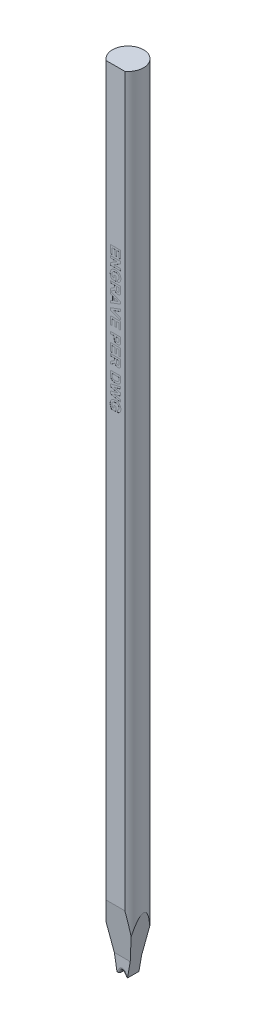
from build123d import *

# Parameters (mm, degrees)
SKETCH_TL_CUTTING_R       = 1.4986
TL_CUTTING_DEPTH          = 75.9968
SKETCH_TDF_GRINDING_W     = 3.0172
SKETCH_TDF_GRINDING_H     = 3.0172
TDF_GRINDING_DEPTH        = 77.026345527
ENGRAVING_DEPTH           = 0.005
VW_VR_GRINDING_DEPTH      = 1.5086
VW_VR_GRINDING_DEPTH_BACK = 1.5086
ISA_GRINDING_DEPTH        = 1.5086
ISA_GRINDING_DEPTH_BACK   = 1.5086
PRE_FRX_BRX_DEPTH         = 1.5086
PRE_FRX_BRX_DEPTH_BACK    = 1.5086
SKETCH_PRE_FRX_BRX_W      = 0.95742
SKETCH_PRE_FRX_BRX_H      = 1.4986
SKETCH_PRE_FRX_BRX_W_2    = 0.95996
FR_EDM_R                  = 0.24892
BR_EDM_R                  = 0.24892
FA_BA_GRINDING_DEPTH      = 1.5086
FA_BA_GRINDING_DEPTH_BACK = 1.5086


with BuildPart() as part:
    # sketch_TL_cutting → TL_cutting (new body)
    with BuildSketch(Plane(origin=(0, 0, 0), x_dir=(1, 0, 0), z_dir=(0, 1, 0))):
        Circle(SKETCH_TL_CUTTING_R)
    extrude(amount=TL_CUTTING_DEPTH)

    # sketch_TDF_grinding → TDF_grinding (cut, through all)
    with BuildSketch(Plane(origin=(0, 0, 0), x_dir=(1, 0, 0), z_dir=(0, 1, 0))):
        with Locations((0, -2.71002)):
            Rectangle(SKETCH_TDF_GRINDING_W, SKETCH_TDF_GRINDING_H)
    extrude(amount=TDF_GRINDING_DEPTH, mode=Mode.SUBTRACT)

    # sketch_engraving → engraving (cut)
    # profile 1 of 13: a face of its own
    with BuildSketch(Plane.XY.offset(1.20142)):
        Polygon((-0.5, 60.894235897), (0.5, 60.894235897), (0.5, 60.150646154), (0.333333333, 60.150646154), (0.333333333, 60.701928205), (0.115384615, 60.701928205), (0.115384615, 60.189107692), (-0.051282051, 60.189107692), (-0.051282051, 60.701928205), (-0.333333333, 60.701928205), (-0.333333333, 60.137825641), (-0.5, 60.137825641), align=None)
    # profile 2 of 13: a face of its own
    with BuildSketch(Plane.XY.offset(1.20142)):
        Polygon((-0.5, 59.971158974), (0.5, 59.971158974), (0.5, 59.7702375), (-0.157451923, 59.368594872), (0.5, 59.368594872), (0.5, 59.176287179), (-0.5, 59.176287179), (-0.5, 59.38341859), (0.147035256, 59.778851282), (-0.5, 59.778851282), align=None)
    # profile 3 of 13: a face of its own
    with BuildSketch(Plane.XY.offset(1.20142)):
        with BuildLine():
            Line((-0.128205128, 58.522441026), (0.038461538, 58.522441026))
            Line((0.038461538, 58.522441026), (0.038461538, 58.08654359))
            Line((0.038461538, 58.08654359), (-0.36338141, 58.08654359))
            add(Edge.make_bspline(
                [(-0.36338141, 58.08654359), (-0.368321434, 58.092029605), (-0.378419843, 58.103244131), (-0.392661125, 58.121541895), (-0.406257259, 58.14168601), (-0.4194836, 58.1635547), (-0.432233696, 58.187193223), (-0.444685123, 58.212507295), (-0.45671611, 58.239543622), (-0.471787381, 58.277776941), (-0.488186169, 58.326991061), (-0.502445448, 58.387156306), (-0.511191227, 58.447797498), (-0.512277771, 58.488358306), (-0.512820513, 58.50861891)],
                knots=[0, 0, 0, 0, 0.581799769, 1.189316438, 1.825828404, 2.496525428, 3.203088405, 3.942228803, 4.719818701, 5.534979611, 7.181138583, 8.803804008, 10.403462225, 12, 12, 12, 12], degree=3))
            add(Edge.make_bspline(
                [(-0.512820513, 58.50861891), (-0.512629241, 58.521311396), (-0.512252188, 58.546332062), (-0.509233571, 58.583270349), (-0.504017902, 58.618987455), (-0.496780719, 58.653419967), (-0.487836372, 58.686670877), (-0.476607913, 58.718623396), (-0.463065488, 58.749243299), (-0.447986133, 58.778759812), (-0.430657849, 58.806612408), (-0.411724289, 58.832856254), (-0.390891397, 58.857236635), (-0.36853351, 58.879965448), (-0.344060025, 58.900614033), (-0.318106216, 58.919695872), (-0.290219674, 58.936754268), (-0.260879177, 58.95208079), (-0.230317098, 58.965710173), (-0.198781008, 58.977212477), (-0.166726875, 58.987296153), (-0.134042675, 58.995583938), (-0.10062201, 59.001670885), (-0.066619552, 59.00640276), (-0.031822841, 59.008944234), (-0.008417054, 59.009393556), (0.003405449, 59.009620513)],
                knots=[0, 0, 0, 0, 1.124897971, 2.217508473, 3.282174662, 4.322209414, 5.334422951, 6.332119154, 7.320662553, 8.300074908, 9.267468154, 10.225199689, 11.165658754, 12.107290334, 13.047749399, 14.00069605, 14.959944213, 15.942088746, 16.933021067, 17.923599838, 18.915715637, 19.910475908, 20.909926025, 21.925232038, 22.952013513, 24, 24, 24, 24], degree=3))
            add(Edge.make_bspline(
                [(0.003405449, 59.009620513), (0.016165747, 59.009436614), (0.041321811, 59.009074069), (0.078501182, 59.005944425), (0.114594914, 59.00109647), (0.149519517, 58.993701478), (0.183523729, 58.984848027), (0.216299841, 58.973503339), (0.248180515, 58.960549892), (0.278688999, 58.945265774), (0.308028284, 58.928383202), (0.335510174, 58.909199631), (0.361403632, 58.88838003), (0.385591047, 58.865737199), (0.407627145, 58.840898237), (0.428063784, 58.814372539), (0.447146094, 58.78617769), (0.457908016, 58.766000967), (0.463341346, 58.755814423)],
                knots=[0, 0, 0, 0, 1.105132952, 2.178694671, 3.229818344, 4.257558797, 5.269123684, 6.27148554, 7.259679084, 8.247804916, 9.224967877, 10.189258471, 11.147685264, 12.101072275, 13.055511435, 14.02039165, 15.000562851, 16, 16, 16, 16], degree=3))
            add(Edge.make_bspline(
                [(0.463341346, 58.755814423), (0.467347168, 58.747727072), (0.475455657, 58.731356849), (0.485329628, 58.705283756), (0.494054347, 58.677916179), (0.500719187, 58.648934703), (0.506115234, 58.618648224), (0.510216979, 58.586907147), (0.512307439, 58.553652939), (0.512647258, 58.530990515), (0.512820513, 58.519436218)],
                knots=[0, 0, 0, 0, 0.887950456, 1.797368171, 2.741221183, 3.713797788, 4.722103116, 5.768966405, 6.862521341, 8, 8, 8, 8], degree=3))
            add(Edge.make_bspline(
                [(0.512820513, 58.519436218), (0.512598613, 58.504538718), (0.512167059, 58.475565835), (0.508571106, 58.433325541), (0.502373597, 58.393571904), (0.493837942, 58.356249565), (0.482863355, 58.321438928), (0.469371425, 58.289199918), (0.453633675, 58.25933466), (0.435019378, 58.232275716), (0.414494937, 58.207473149), (0.392035387, 58.18499168), (0.367607461, 58.164822262), (0.341334074, 58.146951549), (0.313106625, 58.131520198), (0.283182558, 58.118252182), (0.251334696, 58.107331), (0.22921692, 58.102053034), (0.217948718, 58.099364103)],
                knots=[0, 0, 0, 0, 1.271135529, 2.472123572, 3.614091059, 4.701890498, 5.736279567, 6.724681829, 7.680621489, 8.611506429, 9.52200816, 10.424540711, 11.318996785, 12.221421405, 13.131851814, 14.060431888, 15.011860567, 16, 16, 16, 16], degree=3))
            Line((0.217948718, 58.099364103), (0.179487179, 58.291671795))
            add(Edge.make_bspline(
                [(0.179487179, 58.291671795), (0.185798707, 58.293574377), (0.198251232, 58.297328136), (0.216108293, 58.304634712), (0.232994438, 58.312952834), (0.248643132, 58.322779827), (0.263649233, 58.333217482), (0.277161531, 58.345487665), (0.290187329, 58.358394684), (0.301701762, 58.37288584), (0.312086782, 58.388324395), (0.321450083, 58.404545863), (0.329043783, 58.421914205), (0.335153652, 58.440186828), (0.340342569, 58.459274233), (0.343533767, 58.479425571), (0.345940549, 58.50041453), (0.346081986, 58.514754556), (0.346153846, 58.522040385)],
                knots=[0, 0, 0, 0, 1.027780279, 2.027791312, 3.006028774, 3.96000864, 4.908113241, 5.852721087, 6.802883308, 7.765918715, 8.733730415, 9.704005314, 10.683351261, 11.68471758, 12.707948499, 13.764514378, 14.864202456, 16, 16, 16, 16], degree=3))
            add(Edge.make_bspline(
                [(0.346153846, 58.522040385), (0.345859633, 58.533067741), (0.34528545, 58.554588568), (0.341538784, 58.586006107), (0.334873123, 58.615645672), (0.325679114, 58.64358477), (0.313877959, 58.669874621), (0.299029501, 58.694159968), (0.282012344, 58.717045501), (0.262039987, 58.737879978), (0.239645267, 58.756774481), (0.214561065, 58.773131053), (0.186868462, 58.78674783), (0.156706511, 58.797900746), (0.124073954, 58.806780847), (0.088855272, 58.812804995), (0.051104495, 58.816741063), (0.02505068, 58.817118323), (0.01161859, 58.817312821)],
                knots=[0, 0, 0, 0, 1.043810997, 2.037086103, 2.989314757, 3.91471467, 4.817033861, 5.710208705, 6.603920097, 7.511448416, 8.435617211, 9.371747005, 10.338444094, 11.350425613, 12.411431869, 13.5347293, 14.729025275, 16, 16, 16, 16], degree=3))
            add(Edge.make_bspline(
                [(0.01161859, 58.817312821), (-0.002813331, 58.817110147), (-0.03086261, 58.816716238), (-0.071503034, 58.812881337), (-0.109371212, 58.806583116), (-0.14440027, 58.797515757), (-0.176807311, 58.786208494), (-0.206438048, 58.772228966), (-0.233109204, 58.75542113), (-0.256980675, 58.736358295), (-0.278169336, 58.715321484), (-0.296147735, 58.692258524), (-0.31184176, 58.668000317), (-0.32420794, 58.641860517), (-0.33413508, 58.614312028), (-0.341078682, 58.585085999), (-0.345395871, 58.554287729), (-0.345897627, 58.533206176), (-0.346153846, 58.522441026)],
                knots=[0, 0, 0, 0, 1.31821493, 2.562027667, 3.72541598, 4.821825939, 5.863743127, 6.857000185, 7.808227391, 8.737146514, 9.643023621, 10.529087527, 11.404035307, 12.277173472, 13.164790074, 14.074766194, 15.016892606, 16, 16, 16, 16], degree=3))
            add(Edge.make_bspline(
                [(-0.346153846, 58.522441026), (-0.345850315, 58.511537735), (-0.34524035, 58.489626847), (-0.340086045, 58.456805767), (-0.332449955, 58.423805514), (-0.321065283, 58.391413163), (-0.307937779, 58.360026456), (-0.292687307, 58.330860255), (-0.276962331, 58.303467677), (-0.264654274, 58.2869552), (-0.258613782, 58.278851282)],
                knots=[0, 0, 0, 0, 0.993779204, 1.997065276, 3.023588959, 4.078879359, 5.123947549, 6.123456565, 7.079038607, 8, 8, 8, 8], degree=3))
            Line((-0.258613782, 58.278851282), (-0.128205128, 58.278851282))
            Line((-0.128205128, 58.278851282), (-0.128205128, 58.522441026))
        make_face()
    # profile 4 of 13: a face of its own
    with BuildSketch(Plane.XY.offset(1.20142)):
        with BuildLine():
            Line((-0.5, 57.894235897), (0.5, 57.894235897))
            Line((0.5, 57.894235897), (0.5, 57.474564423))
            add(Edge.make_bspline(
                [(0.5, 57.474564423), (0.499921351, 57.461810201), (0.499769781, 57.437230481), (0.498665723, 57.401683268), (0.496349389, 57.368901265), (0.493735057, 57.338736822), (0.489890849, 57.311277094), (0.485377151, 57.286456079), (0.480042652, 57.264353829), (0.473762142, 57.2447266), (0.46640441, 57.226899938), (0.457825047, 57.210235326), (0.447696774, 57.194575272), (0.436444977, 57.179714477), (0.424039539, 57.165595254), (0.410155618, 57.152603274), (0.394999014, 57.140512567), (0.378696089, 57.129332781), (0.361318758, 57.119484096), (0.343425117, 57.110484982), (0.324824746, 57.103159364), (0.305605269, 57.09710847), (0.285808412, 57.092274923), (0.265383845, 57.088920032), (0.244368538, 57.086825611), (0.230173307, 57.086638641), (0.222956731, 57.08654359)],
                knots=[0, 0, 0, 0, 1.675792322, 3.229558513, 4.671612708, 5.993327294, 7.206773438, 8.313218507, 9.306927966, 10.191988363, 11.018030861, 11.838135071, 12.650980327, 13.465150207, 14.285535933, 15.117196726, 15.959844754, 16.83101188, 17.711363548, 18.582398133, 19.460517458, 20.334551361, 21.228266118, 22.135486512, 23.052118027, 24, 24, 24, 24], degree=3))
            add(Edge.make_bspline(
                [(0.222956731, 57.08654359), (0.213865176, 57.08671771), (0.196097772, 57.087057988), (0.170067915, 57.090259374), (0.145135532, 57.094860931), (0.121515047, 57.101974247), (0.099028777, 57.110818829), (0.077834712, 57.121624821), (0.057734109, 57.134377691), (0.039011166, 57.149143067), (0.021628172, 57.165861702), (0.005964946, 57.184627919), (-0.008142217, 57.205317705), (-0.020271369, 57.228100383), (-0.030960543, 57.252583224), (-0.039742833, 57.279088699), (-0.046961528, 57.30748005), (-0.050349413, 57.327234525), (-0.052083333, 57.337344872)],
                knots=[0, 0, 0, 0, 1.059179627, 2.069928931, 3.052909591, 4.01082991, 4.940120368, 5.865982481, 6.779263376, 7.710344595, 8.640547144, 9.585223395, 10.554458868, 11.553878165, 12.589111246, 13.664634927, 14.804759383, 16, 16, 16, 16], degree=3))
            add(Edge.make_bspline(
                [(-0.052083333, 57.337344872), (-0.058543192, 57.327554557), (-0.071157156, 57.308437315), (-0.092244136, 57.282140986), (-0.113935974, 57.258182324), (-0.13350323, 57.240195798), (-0.150629326, 57.226361316), (-0.165615492, 57.215228495), (-0.182859981, 57.203217912), (-0.202374991, 57.19044991), (-0.22398696, 57.176546224), (-0.248026974, 57.162024206), (-0.274260457, 57.146579885), (-0.292585876, 57.136196031), (-0.302083333, 57.130814423)],
                knots=[0, 0, 0, 0, 1.285482994, 2.510122655, 3.691653098, 4.826411195, 5.419869803, 6.105175889, 6.872935239, 7.723789235, 8.662129684, 9.690525463, 10.803075916, 12, 12, 12, 12], degree=3))
            Line((-0.302083333, 57.130814423), (-0.5, 57.009620513))
            Line((-0.5, 57.009620513), (-0.5, 57.234380128))
            Line((-0.5, 57.234380128), (-0.273036859, 57.376607692))
            add(Edge.make_bspline(
                [(-0.273036859, 57.376607692), (-0.263945443, 57.383137401), (-0.24658806, 57.395603957), (-0.221949287, 57.41363509), (-0.199893124, 57.430036608), (-0.1805544, 57.444827372), (-0.163731826, 57.457827709), (-0.149845803, 57.469482343), (-0.138230202, 57.479219639), (-0.126725879, 57.490254127), (-0.114887633, 57.503080533), (-0.103494307, 57.518942305), (-0.094238036, 57.535123543), (-0.087286311, 57.55262809), (-0.082478883, 57.572919627), (-0.079343719, 57.597279092), (-0.077067211, 57.626432144), (-0.076973557, 57.647502303), (-0.076923077, 57.658859295)],
                knots=[0, 0, 0, 0, 1.465382114, 2.797715724, 3.99708711, 5.063614826, 5.985194575, 6.779875669, 7.43696127, 7.968700361, 8.866038685, 9.717629234, 10.520014012, 11.30082289, 12.174340694, 13.242479345, 14.513673363, 16, 16, 16, 16], degree=3))
            Line((-0.076923077, 57.658859295), (-0.076923077, 57.701928205))
            Line((-0.076923077, 57.701928205), (-0.5, 57.701928205))
            Line((-0.5, 57.701928205), (-0.5, 57.894235897))
        make_face()
        with BuildLine():
            Line((0.08974359, 57.701928205), (0.08974359, 57.547080449))
            add(Edge.make_bspline(
                [(0.08974359, 57.547080449), (0.089768957, 57.5351274), (0.089817287, 57.512354821), (0.090527354, 57.479971991), (0.091115821, 57.451109113), (0.09265079, 57.425809153), (0.094114881, 57.404019334), (0.096069001, 57.385767128), (0.09836301, 57.371028848), (0.101931469, 57.356307986), (0.108148092, 57.341228202), (0.117003495, 57.325158518), (0.128487921, 57.311415466), (0.141777239, 57.299542986), (0.157332372, 57.290378485), (0.174706183, 57.283657484), (0.193862841, 57.279643774), (0.20724563, 57.279120802), (0.214142628, 57.278851282)],
                knots=[0, 0, 0, 0, 1.698120923, 3.235207303, 4.601799022, 5.7989489, 6.835765357, 7.704239165, 8.40605236, 8.953649664, 9.852072573, 10.714567413, 11.550246753, 12.383769498, 13.234656382, 14.099651817, 15.020630301, 16, 16, 16, 16], degree=3))
            add(Edge.make_bspline(
                [(0.214142628, 57.278851282), (0.221852989, 57.27918604), (0.236728888, 57.2798319), (0.257822961, 57.285086949), (0.27662771, 57.293834428), (0.292813882, 57.306323618), (0.306623576, 57.32192236), (0.317392842, 57.340646681), (0.325576055, 57.362091747), (0.328565774, 57.377545804), (0.330128205, 57.385622115)],
                knots=[0, 0, 0, 0, 1.062451802, 2.049829439, 2.976851779, 3.903462222, 4.849641532, 5.832195941, 6.867102576, 8, 8, 8, 8], degree=3))
            add(Edge.make_bspline(
                [(0.330128205, 57.385622115), (0.330421459, 57.388291011), (0.331116534, 57.394616853), (0.331562949, 57.405787541), (0.332249138, 57.420070698), (0.332529569, 57.437639208), (0.333021138, 57.458336115), (0.333111403, 57.482243719), (0.333399792, 57.509286063), (0.333356297, 57.528383752), (0.333333333, 57.538466667)],
                knots=[0, 0, 0, 0, 0.42127143, 0.998501726, 1.753681744, 2.66564073, 3.755712164, 5.002818897, 6.417592707, 8, 8, 8, 8], degree=3))
            Line((0.333333333, 57.538466667), (0.333333333, 57.701928205))
            Line((0.333333333, 57.701928205), (0.08974359, 57.701928205))
        make_face(mode=Mode.SUBTRACT)
    # profile 5 of 13: a face of its own
    with BuildSketch(Plane.XY.offset(1.20142)):
        Polygon((-0.5, 56.035261538), (-0.5, 56.239187821), (-0.269230769, 56.323522756), (-0.269230769, 56.707336859), (-0.5, 56.791671795), (-0.5, 56.9968), (0.5, 56.618795192), (0.5, 56.415069231), align=None)
        Polygon((-0.102564103, 56.384620513), (0.256410256, 56.516030769), (-0.102564103, 56.647040385), align=None, mode=Mode.SUBTRACT)
    # profile 6 of 13: a face of its own
    with BuildSketch(Plane.XY.offset(1.20142)):
        Polygon((-0.5, 55.627008333), (0.5, 55.9968), (0.5, 55.793675), (-0.243589744, 55.528851282), (0.5, 55.265029167), (0.5, 55.060902564), (-0.5, 55.429291987), align=None)
    # profile 7 of 13: a face of its own
    with BuildSketch(Plane.XY.offset(1.20142)):
        Polygon((-0.5, 54.971158974), (0.5, 54.971158974), (0.5, 54.227569231), (0.333333333, 54.227569231), (0.333333333, 54.778851282), (0.115384615, 54.778851282), (0.115384615, 54.266030769), (-0.051282051, 54.266030769), (-0.051282051, 54.778851282), (-0.333333333, 54.778851282), (-0.333333333, 54.214748718), (-0.5, 54.214748718), align=None)
    # profile 8 of 13: a face of its own
    with BuildSketch(Plane.XY.offset(1.20142)):
        with BuildLine():
            Line((-0.5, 53.663466667), (0.5, 53.663466667))
            Line((0.5, 53.663466667), (0.5, 53.343554808))
            add(Edge.make_bspline(
                [(0.5, 53.343554808), (0.4999852, 53.329064455), (0.499956962, 53.301416693), (0.499104777, 53.261884062), (0.497929464, 53.226289855), (0.496434625, 53.194622803), (0.494248137, 53.166966334), (0.491629455, 53.143258956), (0.488933209, 53.123391744), (0.486060508, 53.111634128), (0.484775641, 53.106375321)],
                knots=[0, 0, 0, 0, 1.460492613, 2.786636817, 3.985312262, 5.05006335, 5.98179196, 6.7807735, 7.454678796, 8, 8, 8, 8], degree=3))
            add(Edge.make_bspline(
                [(0.484775641, 53.106375321), (0.482781564, 53.099381959), (0.478823789, 53.085501776), (0.470386441, 53.065615803), (0.460608006, 53.04644887), (0.448953875, 53.028241805), (0.435630967, 53.010932663), (0.420747869, 52.994470188), (0.404237636, 52.978765844), (0.386131953, 52.964039765), (0.366525691, 52.950543742), (0.345376234, 52.938912401), (0.322847402, 52.929051925), (0.298873329, 52.921127517), (0.273610941, 52.914575617), (0.246834559, 52.910393024), (0.218752408, 52.907369504), (0.199528035, 52.9071623), (0.189703526, 52.90705641)],
                knots=[0, 0, 0, 0, 0.907183394, 1.800546498, 2.691728384, 3.591410291, 4.495216108, 5.416087871, 6.359626967, 7.337496937, 8.327236581, 9.327316132, 10.346534403, 11.393207653, 12.477041209, 13.600953845, 14.773980723, 16, 16, 16, 16], degree=3))
            add(Edge.make_bspline(
                [(0.189703526, 52.90705641), (0.174784734, 52.907364918), (0.146065241, 52.907958813), (0.104894137, 52.914608263), (0.067280604, 52.924741168), (0.03361575, 52.939582122), (0.003633111, 52.957595209), (-0.023091697, 52.977763014), (-0.046492635, 53.000246245), (-0.066210989, 53.024825478), (-0.082434, 53.050756803), (-0.096247437, 53.076755341), (-0.106871469, 53.103146515), (-0.11149992, 53.12114078), (-0.113782051, 53.130013141)],
                knots=[0, 0, 0, 0, 1.312446177, 2.526530956, 3.662051072, 4.733637382, 5.754065268, 6.735959421, 7.675686778, 8.604015004, 9.502732733, 10.365317746, 11.193993632, 12, 12, 12, 12], degree=3))
            add(Edge.make_bspline(
                [(-0.113782051, 53.130013141), (-0.114986663, 53.136345752), (-0.11752584, 53.149694139), (-0.120056937, 53.170863883), (-0.122858586, 53.194003561), (-0.124685978, 53.219208347), (-0.126397255, 53.24644775), (-0.127205205, 53.275711194), (-0.128178621, 53.306956857), (-0.128196112, 53.328463031), (-0.128205128, 53.339548397)],
                knots=[0, 0, 0, 0, 0.735353946, 1.55003838, 2.431865514, 3.394945452, 4.432993119, 5.54609699, 6.735134699, 8, 8, 8, 8], degree=3))
            Line((-0.128205128, 53.339548397), (-0.128205128, 53.471158974))
            Line((-0.128205128, 53.471158974), (-0.5, 53.471158974))
            Line((-0.5, 53.471158974), (-0.5, 53.663466667))
        make_face()
        with BuildLine():
            Line((0.333333333, 53.471158974), (0.038461538, 53.471158974))
            Line((0.038461538, 53.471158974), (0.038461538, 53.355774359))
            add(Edge.make_bspline(
                [(0.038461538, 53.355774359), (0.038474423, 53.345824233), (0.038499073, 53.32678839), (0.039383856, 53.299476178), (0.040463899, 53.274753138), (0.04225159, 53.252567611), (0.044607724, 53.233053517), (0.047425958, 53.216080173), (0.050450217, 53.201627797), (0.055461898, 53.18599952), (0.063570342, 53.169289767), (0.075224213, 53.151445715), (0.089157789, 53.135769737), (0.105522293, 53.122725245), (0.123704204, 53.112305583), (0.143517189, 53.104845099), (0.164632877, 53.10002787), (0.179260262, 53.099587861), (0.186698718, 53.099364103)],
                knots=[0, 0, 0, 0, 1.411705958, 2.700771114, 3.876961699, 4.922619712, 5.858038221, 6.66485904, 7.363650596, 7.950905807, 8.989198271, 9.987739806, 10.967313358, 11.951275539, 12.944273208, 13.927870418, 14.946261014, 16, 16, 16, 16], degree=3))
            add(Edge.make_bspline(
                [(0.186698718, 53.099364103), (0.195758642, 53.099679017), (0.213324639, 53.100289596), (0.238341551, 53.10702257), (0.261044702, 53.117410781), (0.280727694, 53.132262972), (0.297279472, 53.15020407), (0.31105114, 53.170369116), (0.320688658, 53.193188742), (0.32442284, 53.209338921), (0.326322115, 53.217553205)],
                knots=[0, 0, 0, 0, 1.085904563, 2.105425768, 3.088705091, 4.068969419, 5.045188284, 6.010769642, 6.988240112, 8, 8, 8, 8], degree=3))
            add(Edge.make_bspline(
                [(0.326322115, 53.217553205), (0.326887477, 53.221087999), (0.328142404, 53.228934146), (0.329452077, 53.241976039), (0.330643223, 53.257404601), (0.331621189, 53.275238428), (0.332385732, 53.295406833), (0.333055661, 53.31797634), (0.333109481, 53.342887507), (0.333256648, 53.36031512), (0.333333333, 53.369396154)],
                knots=[0, 0, 0, 0, 0.564603001, 1.253243608, 2.066786758, 3.005752288, 4.070476343, 5.250658742, 6.567396469, 8, 8, 8, 8], degree=3))
            Line((0.333333333, 53.369396154), (0.333333333, 53.471158974))
        make_face(mode=Mode.SUBTRACT)
    # profile 9 of 13: a face of its own
    with BuildSketch(Plane.XY.offset(1.20142)):
        Polygon((-0.5, 52.740389744), (0.5, 52.740389744), (0.5, 51.9968), (0.333333333, 51.9968), (0.333333333, 52.548082051), (0.115384615, 52.548082051), (0.115384615, 52.035261538), (-0.051282051, 52.035261538), (-0.051282051, 52.548082051), (-0.333333333, 52.548082051), (-0.333333333, 51.983979487), (-0.5, 51.983979487), align=None)
    # profile 10 of 13: a face of its own
    with BuildSketch(Plane.XY.offset(1.20142)):
        with BuildLine():
            Line((-0.5, 51.817312821), (0.5, 51.817312821))
            Line((0.5, 51.817312821), (0.5, 51.397641346))
            add(Edge.make_bspline(
                [(0.5, 51.397641346), (0.499921351, 51.384887124), (0.499769781, 51.360307404), (0.498665723, 51.324760191), (0.496349389, 51.291978188), (0.493735057, 51.261813745), (0.489890849, 51.234354017), (0.485377151, 51.209533002), (0.480042652, 51.187430752), (0.473762142, 51.167803523), (0.46640441, 51.149976861), (0.457825047, 51.133312249), (0.447696774, 51.117652195), (0.436444977, 51.1027914), (0.424039539, 51.088672178), (0.410155618, 51.075680198), (0.394999014, 51.06358949), (0.378696089, 51.052409704), (0.361318758, 51.042561019), (0.343425117, 51.033561905), (0.324824746, 51.026236287), (0.305605269, 51.020185393), (0.285808412, 51.015351846), (0.265383845, 51.011996956), (0.244368538, 51.009902534), (0.230173307, 51.009715564), (0.222956731, 51.009620513)],
                knots=[0, 0, 0, 0, 1.675792322, 3.229558513, 4.671612708, 5.993327294, 7.206773438, 8.313218507, 9.306927966, 10.191988363, 11.018030861, 11.838135071, 12.650980327, 13.465150207, 14.285535933, 15.117196726, 15.959844754, 16.83101188, 17.711363548, 18.582398133, 19.460517458, 20.334551361, 21.228266118, 22.135486512, 23.052118027, 24, 24, 24, 24], degree=3))
            add(Edge.make_bspline(
                [(0.222956731, 51.009620513), (0.213865176, 51.009794633), (0.196097772, 51.010134911), (0.170067915, 51.013336297), (0.145135532, 51.017937854), (0.121515047, 51.02505117), (0.099028777, 51.033895752), (0.077834712, 51.044701744), (0.057734109, 51.057454614), (0.039011166, 51.07221999), (0.021628172, 51.088938625), (0.005964946, 51.107704843), (-0.008142217, 51.128394628), (-0.020271369, 51.151177306), (-0.030960543, 51.175660147), (-0.039742833, 51.202165622), (-0.046961528, 51.230556973), (-0.050349413, 51.250311448), (-0.052083333, 51.260421795)],
                knots=[0, 0, 0, 0, 1.059179627, 2.069928931, 3.052909591, 4.01082991, 4.940120368, 5.865982481, 6.779263376, 7.710344595, 8.640547144, 9.585223395, 10.554458868, 11.553878165, 12.589111246, 13.664634927, 14.804759383, 16, 16, 16, 16], degree=3))
            add(Edge.make_bspline(
                [(-0.052083333, 51.260421795), (-0.058543192, 51.25063148), (-0.071157156, 51.231514238), (-0.092244136, 51.205217909), (-0.113935974, 51.181259247), (-0.13350323, 51.163272722), (-0.150629326, 51.149438239), (-0.165615492, 51.138305418), (-0.182859981, 51.126294835), (-0.202374991, 51.113526833), (-0.22398696, 51.099623147), (-0.248026974, 51.085101129), (-0.274260457, 51.069656808), (-0.292585876, 51.059272954), (-0.302083333, 51.053891346)],
                knots=[0, 0, 0, 0, 1.285482994, 2.510122655, 3.691653098, 4.826411195, 5.419869803, 6.105175889, 6.872935239, 7.723789235, 8.662129684, 9.690525463, 10.803075916, 12, 12, 12, 12], degree=3))
            Line((-0.302083333, 51.053891346), (-0.5, 50.932697436))
            Line((-0.5, 50.932697436), (-0.5, 51.157457051))
            Line((-0.5, 51.157457051), (-0.273036859, 51.299684615))
            add(Edge.make_bspline(
                [(-0.273036859, 51.299684615), (-0.263945443, 51.306214324), (-0.24658806, 51.31868088), (-0.221949287, 51.336712013), (-0.199893124, 51.353113531), (-0.1805544, 51.367904295), (-0.163731826, 51.380904632), (-0.149845803, 51.392559266), (-0.138230202, 51.402296562), (-0.126725879, 51.41333105), (-0.114887633, 51.426157456), (-0.103494307, 51.442019228), (-0.094238036, 51.458200466), (-0.087286311, 51.475705013), (-0.082478883, 51.495996551), (-0.079343719, 51.520356015), (-0.077067211, 51.549509067), (-0.076973557, 51.570579226), (-0.076923077, 51.581936218)],
                knots=[0, 0, 0, 0, 1.465382114, 2.797715724, 3.99708711, 5.063614826, 5.985194575, 6.779875669, 7.43696127, 7.968700361, 8.866038685, 9.717629234, 10.520014012, 11.30082289, 12.174340694, 13.242479345, 14.513673363, 16, 16, 16, 16], degree=3))
            Line((-0.076923077, 51.581936218), (-0.076923077, 51.625005128))
            Line((-0.076923077, 51.625005128), (-0.5, 51.625005128))
            Line((-0.5, 51.625005128), (-0.5, 51.817312821))
        make_face()
        with BuildLine():
            Line((0.08974359, 51.625005128), (0.08974359, 51.470157372))
            add(Edge.make_bspline(
                [(0.08974359, 51.470157372), (0.089768957, 51.458204323), (0.089817287, 51.435431744), (0.090527354, 51.403048914), (0.091115821, 51.374186036), (0.09265079, 51.348886076), (0.094114881, 51.327096257), (0.096069001, 51.308844051), (0.09836301, 51.294105771), (0.101931469, 51.279384909), (0.108148092, 51.264305125), (0.117003495, 51.248235441), (0.128487921, 51.234492389), (0.141777239, 51.222619909), (0.157332372, 51.213455408), (0.174706183, 51.206734407), (0.193862841, 51.202720697), (0.20724563, 51.202197726), (0.214142628, 51.201928205)],
                knots=[0, 0, 0, 0, 1.698120923, 3.235207303, 4.601799022, 5.7989489, 6.835765357, 7.704239165, 8.40605236, 8.953649664, 9.852072573, 10.714567413, 11.550246753, 12.383769498, 13.234656382, 14.099651817, 15.020630301, 16, 16, 16, 16], degree=3))
            add(Edge.make_bspline(
                [(0.214142628, 51.201928205), (0.221852989, 51.202262963), (0.236728888, 51.202908823), (0.257822961, 51.208163872), (0.27662771, 51.216911351), (0.292813882, 51.229400541), (0.306623576, 51.244999283), (0.317392842, 51.263723604), (0.325576055, 51.28516867), (0.328565774, 51.300622727), (0.330128205, 51.308699038)],
                knots=[0, 0, 0, 0, 1.062451802, 2.049829439, 2.976851779, 3.903462222, 4.849641532, 5.832195941, 6.867102576, 8, 8, 8, 8], degree=3))
            add(Edge.make_bspline(
                [(0.330128205, 51.308699038), (0.330421459, 51.311367934), (0.331116534, 51.317693776), (0.331562949, 51.328864464), (0.332249138, 51.343147621), (0.332529569, 51.360716131), (0.333021138, 51.381413038), (0.333111403, 51.405320642), (0.333399792, 51.432362986), (0.333356297, 51.451460675), (0.333333333, 51.46154359)],
                knots=[0, 0, 0, 0, 0.42127143, 0.998501726, 1.753681744, 2.66564073, 3.755712164, 5.002818897, 6.417592707, 8, 8, 8, 8], degree=3))
            Line((0.333333333, 51.46154359), (0.333333333, 51.625005128))
            Line((0.333333333, 51.625005128), (0.08974359, 51.625005128))
        make_face(mode=Mode.SUBTRACT)
    # profile 11 of 13: a face of its own
    with BuildSketch(Plane.XY.offset(1.20142)):
        with BuildLine():
            Line((0.5, 50.432697436), (0.5, 50.065910577))
            add(Edge.make_bspline(
                [(0.5, 50.065910577), (0.500005193, 50.055893032), (0.500015306, 50.036386546), (0.498840892, 50.008077527), (0.497659587, 49.981604956), (0.495294873, 49.957044813), (0.492816233, 49.934311894), (0.489678088, 49.913365404), (0.485656212, 49.894337663), (0.482484481, 49.882338781), (0.480969551, 49.876607692)],
                knots=[0, 0, 0, 0, 1.259756885, 2.453039283, 3.563158368, 4.591894114, 5.55549294, 6.43918076, 7.254497783, 8, 8, 8, 8], degree=3))
            add(Edge.make_bspline(
                [(0.480969551, 49.876607692), (0.478637325, 49.869438716), (0.474014881, 49.855229893), (0.465827813, 49.83437684), (0.455960096, 49.814542941), (0.445111978, 49.79526828), (0.432903728, 49.776996015), (0.419595761, 49.759281335), (0.404753223, 49.742648264), (0.383633179, 49.721113601), (0.35420815, 49.696688717), (0.315375005, 49.670858181), (0.272594656, 49.649120476), (0.234409605, 49.633929103), (0.20183843, 49.623885004), (0.175754603, 49.617316602), (0.148301213, 49.611644929), (0.119383738, 49.607394754), (0.08913491, 49.603733367), (0.057465542, 49.601105699), (0.024383276, 49.599804712), (0.001870575, 49.599512956), (-0.009615385, 49.599364103)],
                knots=[0, 0, 0, 0, 0.745431882, 1.477436776, 2.212739876, 2.934276521, 3.663147754, 4.384200836, 5.123377481, 5.865761747, 7.365547505, 8.894711587, 10.468722596, 12.101948761, 12.951987285, 13.837595333, 14.760899389, 15.722756883, 16.726861385, 17.773652936, 18.864119771, 20, 20, 20, 20], degree=3))
            add(Edge.make_bspline(
                [(-0.009615385, 49.599364103), (-0.0294616, 49.599755507), (-0.067834928, 49.600512302), (-0.123301552, 49.606109673), (-0.17465514, 49.61540511), (-0.206804138, 49.625115536), (-0.222355769, 49.629812821)],
                knots=[0, 0, 0, 0, 1.103491527, 2.133638164, 3.0971734, 4, 4, 4, 4], degree=3))
            add(Edge.make_bspline(
                [(-0.222355769, 49.629812821), (-0.231274521, 49.632986465), (-0.248819098, 49.639229518), (-0.274127236, 49.650154394), (-0.298211673, 49.661958799), (-0.321053432, 49.674740646), (-0.342549771, 49.688564513), (-0.362636394, 49.703482107), (-0.381577746, 49.719262192), (-0.393236239, 49.730693951), (-0.399038462, 49.736383333)],
                knots=[0, 0, 0, 0, 1.090884612, 2.145940218, 3.175104604, 4.181306866, 5.161203701, 6.118658341, 7.063689906, 8, 8, 8, 8], degree=3))
            add(Edge.make_bspline(
                [(-0.399038462, 49.736383333), (-0.407300305, 49.745669607), (-0.424264154, 49.764736893), (-0.445652736, 49.798088411), (-0.464086504, 49.835963738), (-0.473760833, 49.863277629), (-0.478766026, 49.877408974)],
                knots=[0, 0, 0, 0, 0.912008655, 1.872605891, 2.89935344, 4, 4, 4, 4], degree=3))
            add(Edge.make_bspline(
                [(-0.478766026, 49.877408974), (-0.4805228, 49.883128948), (-0.484168894, 49.895000457), (-0.488062998, 49.913823906), (-0.492165475, 49.933918409), (-0.49463687, 49.955515685), (-0.497243066, 49.978391543), (-0.498706299, 50.002728283), (-0.49974511, 50.028441542), (-0.499913777, 50.046077636), (-0.5, 50.055093269)],
                knots=[0, 0, 0, 0, 0.799129865, 1.658552685, 2.566799617, 3.538529252, 4.561352959, 5.643373779, 6.795284424, 8, 8, 8, 8], degree=3))
            Line((-0.5, 50.055093269), (-0.5, 50.432697436))
            Line((-0.5, 50.432697436), (0.5, 50.432697436))
        make_face()
        with BuildLine():
            Line((0.333333333, 50.240389744), (-0.333333333, 50.240389744))
            Line((-0.333333333, 50.240389744), (-0.333333333, 50.082136538))
            add(Edge.make_bspline(
                [(-0.333333333, 50.082136538), (-0.333276671, 50.074991821), (-0.333167574, 50.061235511), (-0.332847006, 50.041329778), (-0.331979167, 50.023036576), (-0.331080228, 50.006260076), (-0.329595022, 49.991043952), (-0.328134266, 49.977321997), (-0.326090699, 49.965170593), (-0.324477534, 49.957665588), (-0.323717949, 49.954131731)],
                knots=[0, 0, 0, 0, 1.333384787, 2.567275092, 3.714769766, 4.750907381, 5.701951617, 6.567520054, 7.325492842, 8, 8, 8, 8], degree=3))
            add(Edge.make_bspline(
                [(-0.323717949, 49.954131731), (-0.321509316, 49.945855036), (-0.317207482, 49.929734219), (-0.307617456, 49.907098961), (-0.296048139, 49.886616969), (-0.282136533, 49.867945232), (-0.26455548, 49.851118131), (-0.242070693, 49.836754145), (-0.215254411, 49.823460653), (-0.189584523, 49.814357267), (-0.16665678, 49.807822874), (-0.147412959, 49.803399626), (-0.126593091, 49.799904053), (-0.104279343, 49.796897404), (-0.080500412, 49.79446796), (-0.055170426, 49.792956245), (-0.028320392, 49.79192449), (-0.009883527, 49.791757622), (-0.000400641, 49.791671795)],
                knots=[0, 0, 0, 0, 1.038686998, 2.023088296, 2.974059649, 3.888265163, 4.839857954, 5.909819677, 7.113156087, 8.466843969, 9.20827164, 10.006482943, 10.861893492, 11.769681931, 12.739021491, 13.762258324, 14.849031541, 16, 16, 16, 16], degree=3))
            add(Edge.make_bspline(
                [(-0.000400641, 49.791671795), (0.009082275, 49.791756962), (0.027452469, 49.791921946), (0.054102292, 49.792952126), (0.079033415, 49.794455325), (0.102276578, 49.796902152), (0.123864169, 49.799861918), (0.143813574, 49.803399353), (0.161996804, 49.807792884), (0.183589283, 49.814345973), (0.207947697, 49.824183458), (0.23429421, 49.838009661), (0.2571147, 49.854274863), (0.276689574, 49.872630019), (0.29287817, 49.893717031), (0.306422028, 49.917087832), (0.316938162, 49.943218741), (0.321416742, 49.961807779), (0.323717949, 49.971359295)],
                knots=[0, 0, 0, 0, 1.118059345, 2.165891593, 3.144157881, 4.062285166, 4.920717571, 5.712910489, 6.449981617, 7.12489426, 8.371943983, 9.541298068, 10.624898781, 11.666293176, 12.69306237, 13.747704633, 14.842713931, 16, 16, 16, 16], degree=3))
            add(Edge.make_bspline(
                [(0.323717949, 49.971359295), (0.324486218, 49.975493605), (0.326177652, 49.984595773), (0.328151987, 49.999700032), (0.329628909, 50.01748664), (0.331099472, 50.037915577), (0.331977905, 50.060965526), (0.332859431, 50.086671032), (0.333166326, 50.115055313), (0.333276065, 50.134887669), (0.333333333, 50.1452375)],
                knots=[0, 0, 0, 0, 0.578739524, 1.274162912, 2.095457587, 3.035141998, 4.093102578, 5.270121571, 6.575369351, 8, 8, 8, 8], degree=3))
            Line((0.333333333, 50.1452375), (0.333333333, 50.240389744))
        make_face(mode=Mode.SUBTRACT)
    # profile 12 of 13: a face of its own
    with BuildSketch(Plane.XY.offset(1.20142)):
        Polygon((-0.5, 49.295878526), (0.5, 49.535261538), (0.5, 49.338146154), (-0.186899038, 49.182697436), (0.5, 49.018234295), (0.5, 48.755814423), (-0.198517628, 48.592953846), (0.5, 48.437905769), (0.5, 48.240389744), (-0.5, 48.475365705), (-0.5, 48.713546795), (0.247596154, 48.887825641), (-0.5, 49.066711859), align=None)
    # profile 13 of 13: a face of its own
    with BuildSketch(Plane.XY.offset(1.20142)):
        with BuildLine():
            Line((-0.128205128, 47.676287179), (0.038461538, 47.676287179))
            Line((0.038461538, 47.676287179), (0.038461538, 47.240389744))
            Line((0.038461538, 47.240389744), (-0.36338141, 47.240389744))
            add(Edge.make_bspline(
                [(-0.36338141, 47.240389744), (-0.368321434, 47.245875759), (-0.378419843, 47.257090285), (-0.392661125, 47.275388049), (-0.406257259, 47.295532164), (-0.4194836, 47.317400854), (-0.432233696, 47.341039376), (-0.444685123, 47.366353449), (-0.45671611, 47.393389776), (-0.471787381, 47.431623095), (-0.488186169, 47.480837215), (-0.502445448, 47.54100246), (-0.511191227, 47.601643651), (-0.512277771, 47.64220446), (-0.512820513, 47.662465064)],
                knots=[0, 0, 0, 0, 0.581799769, 1.189316438, 1.825828404, 2.496525428, 3.203088405, 3.942228803, 4.719818701, 5.534979611, 7.181138583, 8.803804008, 10.403462225, 12, 12, 12, 12], degree=3))
            add(Edge.make_bspline(
                [(-0.512820513, 47.662465064), (-0.512629241, 47.67515755), (-0.512252188, 47.700178215), (-0.509233571, 47.737116503), (-0.504017902, 47.772833609), (-0.496780719, 47.807266121), (-0.487836372, 47.84051703), (-0.476607913, 47.87246955), (-0.463065488, 47.903089453), (-0.447986133, 47.932605966), (-0.430657849, 47.960458562), (-0.411724289, 47.986702408), (-0.390891397, 48.011082789), (-0.36853351, 48.033811601), (-0.344060025, 48.054460187), (-0.318106216, 48.073542026), (-0.290219674, 48.090600422), (-0.260879177, 48.105926944), (-0.230317098, 48.119556327), (-0.198781008, 48.13105863), (-0.166726875, 48.141142307), (-0.134042675, 48.149430092), (-0.10062201, 48.155517039), (-0.066619552, 48.160248914), (-0.031822841, 48.162790388), (-0.008417054, 48.16323971), (0.003405449, 48.163466667)],
                knots=[0, 0, 0, 0, 1.124897971, 2.217508473, 3.282174662, 4.322209414, 5.334422951, 6.332119154, 7.320662553, 8.300074908, 9.267468154, 10.225199689, 11.165658754, 12.107290334, 13.047749399, 14.00069605, 14.959944213, 15.942088746, 16.933021067, 17.923599838, 18.915715637, 19.910475908, 20.909926025, 21.925232038, 22.952013513, 24, 24, 24, 24], degree=3))
            add(Edge.make_bspline(
                [(0.003405449, 48.163466667), (0.016165747, 48.163282768), (0.041321811, 48.162920223), (0.078501182, 48.159790579), (0.114594914, 48.154942624), (0.149519517, 48.147547632), (0.183523729, 48.13869418), (0.216299841, 48.127349493), (0.248180515, 48.114396046), (0.278688999, 48.099111928), (0.308028284, 48.082229356), (0.335510174, 48.063045784), (0.361403632, 48.042226184), (0.385591047, 48.019583353), (0.407627145, 47.994744391), (0.428063784, 47.968218692), (0.447146094, 47.940023844), (0.457908016, 47.919847121), (0.463341346, 47.909660577)],
                knots=[0, 0, 0, 0, 1.105132952, 2.178694671, 3.229818344, 4.257558797, 5.269123684, 6.27148554, 7.259679084, 8.247804916, 9.224967877, 10.189258471, 11.147685264, 12.101072275, 13.055511435, 14.02039165, 15.000562851, 16, 16, 16, 16], degree=3))
            add(Edge.make_bspline(
                [(0.463341346, 47.909660577), (0.467347168, 47.901573226), (0.475455657, 47.885203002), (0.485329628, 47.859129909), (0.494054347, 47.831762333), (0.500719187, 47.802780857), (0.506115234, 47.772494378), (0.510216979, 47.740753301), (0.512307439, 47.707499093), (0.512647258, 47.684836668), (0.512820513, 47.673282372)],
                knots=[0, 0, 0, 0, 0.887950456, 1.797368171, 2.741221183, 3.713797788, 4.722103116, 5.768966405, 6.862521341, 8, 8, 8, 8], degree=3))
            add(Edge.make_bspline(
                [(0.512820513, 47.673282372), (0.512598613, 47.658384872), (0.512167059, 47.629411989), (0.508571106, 47.587171695), (0.502373597, 47.547418058), (0.493837942, 47.510095719), (0.482863355, 47.475285082), (0.469371425, 47.443046072), (0.453633675, 47.413180814), (0.435019378, 47.386121869), (0.414494937, 47.361319302), (0.392035387, 47.338837834), (0.367607461, 47.318668415), (0.341334074, 47.300797703), (0.313106625, 47.285366351), (0.283182558, 47.272098336), (0.251334696, 47.261177154), (0.22921692, 47.255899188), (0.217948718, 47.253210256)],
                knots=[0, 0, 0, 0, 1.271135529, 2.472123572, 3.614091059, 4.701890498, 5.736279567, 6.724681829, 7.680621489, 8.611506429, 9.52200816, 10.424540711, 11.318996785, 12.221421405, 13.131851814, 14.060431888, 15.011860567, 16, 16, 16, 16], degree=3))
            Line((0.217948718, 47.253210256), (0.179487179, 47.445517949))
            add(Edge.make_bspline(
                [(0.179487179, 47.445517949), (0.185798707, 47.447420531), (0.198251232, 47.451174289), (0.216108293, 47.458480866), (0.232994438, 47.466798988), (0.248643132, 47.476625981), (0.263649233, 47.487063636), (0.277161531, 47.499333819), (0.290187329, 47.512240837), (0.301701762, 47.526731994), (0.312086782, 47.542170549), (0.321450083, 47.558392017), (0.329043783, 47.575760359), (0.335153652, 47.594032982), (0.340342569, 47.613120387), (0.343533767, 47.633271725), (0.345940549, 47.654260684), (0.346081986, 47.66860071), (0.346153846, 47.675886538)],
                knots=[0, 0, 0, 0, 1.027780279, 2.027791312, 3.006028774, 3.96000864, 4.908113241, 5.852721087, 6.802883308, 7.765918715, 8.733730415, 9.704005314, 10.683351261, 11.68471758, 12.707948499, 13.764514378, 14.864202456, 16, 16, 16, 16], degree=3))
            add(Edge.make_bspline(
                [(0.346153846, 47.675886538), (0.345859633, 47.686913895), (0.34528545, 47.708434722), (0.341538784, 47.739852261), (0.334873123, 47.769491826), (0.325679114, 47.797430924), (0.313877959, 47.823720775), (0.299029501, 47.848006122), (0.282012344, 47.870891655), (0.262039987, 47.891726131), (0.239645267, 47.910620635), (0.214561065, 47.926977207), (0.186868462, 47.940593984), (0.156706511, 47.9517469), (0.124073954, 47.960627), (0.088855272, 47.966651148), (0.051104495, 47.970587217), (0.02505068, 47.970964477), (0.01161859, 47.971158974)],
                knots=[0, 0, 0, 0, 1.043810997, 2.037086103, 2.989314757, 3.91471467, 4.817033861, 5.710208705, 6.603920097, 7.511448416, 8.435617211, 9.371747005, 10.338444094, 11.350425613, 12.411431869, 13.5347293, 14.729025275, 16, 16, 16, 16], degree=3))
            add(Edge.make_bspline(
                [(0.01161859, 47.971158974), (-0.002813331, 47.9709563), (-0.03086261, 47.970562392), (-0.071503034, 47.966727491), (-0.109371212, 47.960429269), (-0.14440027, 47.951361911), (-0.176807311, 47.940054648), (-0.206438048, 47.92607512), (-0.233109204, 47.909267284), (-0.256980675, 47.890204449), (-0.278169336, 47.869167638), (-0.296147735, 47.846104678), (-0.31184176, 47.82184647), (-0.32420794, 47.795706671), (-0.33413508, 47.768158182), (-0.341078682, 47.738932153), (-0.345395871, 47.708133883), (-0.345897627, 47.68705233), (-0.346153846, 47.676287179)],
                knots=[0, 0, 0, 0, 1.31821493, 2.562027667, 3.72541598, 4.821825939, 5.863743127, 6.857000185, 7.808227391, 8.737146514, 9.643023621, 10.529087527, 11.404035307, 12.277173472, 13.164790074, 14.074766194, 15.016892606, 16, 16, 16, 16], degree=3))
            add(Edge.make_bspline(
                [(-0.346153846, 47.676287179), (-0.345850315, 47.665383888), (-0.34524035, 47.643473001), (-0.340086045, 47.610651921), (-0.332449955, 47.577651668), (-0.321065283, 47.545259317), (-0.307937779, 47.51387261), (-0.292687307, 47.484706408), (-0.276962331, 47.457313831), (-0.264654274, 47.440801354), (-0.258613782, 47.432697436)],
                knots=[0, 0, 0, 0, 0.993779204, 1.997065276, 3.023588959, 4.078879359, 5.123947549, 6.123456565, 7.079038607, 8, 8, 8, 8], degree=3))
            Line((-0.258613782, 47.432697436), (-0.128205128, 47.432697436))
            Line((-0.128205128, 47.432697436), (-0.128205128, 47.676287179))
        make_face()
    extrude(amount=-ENGRAVING_DEPTH, mode=Mode.SUBTRACT)

    # sketch_VW_VR_grinding → VW_VR_grinding (cut, two sides: drawn at the far end of the back side and taken through both)
    with BuildSketch(Plane.XY.offset(-VW_VR_GRINDING_DEPTH_BACK)):
        with BuildLine():
            Line((-1.4936, -0.01), (-1.4936, 1.4836))
            ThreePointArc((-1.4936, 1.4836), (-1.495064466, 1.487135534), (-1.4986, 1.4886))
            Line((-1.4986, 1.4886), (-1.5086, 1.4886))
            Line((-1.5086, 1.4886), (-1.5086, -0.01))
            Line((-1.5086, -0.01), (-1.4936, -0.01))
        make_face()
        with BuildLine():
            Line((1.4936, -0.01), (1.4936, 1.4836))
            ThreePointArc((1.4936, 1.4836), (1.495064466, 1.487135534), (1.4986, 1.4886))
            Line((1.4986, 1.4886), (1.5086, 1.4886))
            Line((1.5086, 1.4886), (1.5086, -0.01))
            Line((1.5086, -0.01), (1.4936, -0.01))
        make_face()
    extrude(amount=VW_VR_GRINDING_DEPTH + VW_VR_GRINDING_DEPTH_BACK, mode=Mode.SUBTRACT)

    # sketch_ISA_grinding → ISA_grinding (cut, two sides: drawn at the far end of the back side and taken through both)
    with BuildSketch(Plane.XY.offset(-ISA_GRINDING_DEPTH_BACK)):
        Polygon((-0.50038, 0), (-1.5086, 5.717899756), (-1.5086, -0.01), (1.5086, -0.01), (1.5086, 5.717899756), (0.50038, 0), align=None)
    extrude(amount=ISA_GRINDING_DEPTH + ISA_GRINDING_DEPTH_BACK, mode=Mode.SUBTRACT)

    # sketch_pre_FRX_BRX → pre_FRX_BRX (cut, two sides: drawn at the far end of the back side and taken through both)
    with BuildSketch(Plane(origin=(0, 0, 0), x_dir=(0, 0, -1), z_dir=(1, 0, 0)).offset(-PRE_FRX_BRX_DEPTH_BACK)):
        with Locations((-1.02989, 0.7393)):
            Rectangle(SKETCH_PRE_FRX_BRX_W, SKETCH_PRE_FRX_BRX_H)
        with Locations((1.02862, 0.7393)):
            Rectangle(SKETCH_PRE_FRX_BRX_W_2, SKETCH_PRE_FRX_BRX_H)
    extrude(amount=PRE_FRX_BRX_DEPTH + PRE_FRX_BRX_DEPTH_BACK, mode=Mode.SUBTRACT)

    # V-Groove_EDM: sweep along a path in sketch_contour_V-Groove
    with BuildLine(Plane(origin=(0, 0, 0), x_dir=(0, 0, -1), z_dir=(1, 0, 0))) as v_groove_edm_path:
        Line((-1.20142, 0.32004), (-0.00127, 0.32004))
        Line((-0.00127, 0.32004), (1.4986, 0.32004))
    # sketch_section_V-Groove → V-Groove_EDM (sweep, cut)
    with BuildSketch(Plane.XY.offset(1.20142)):
        with BuildLine():
            Line((-2.516534205, -3.2004), (-0.08103223, 0.277857291))
            ThreePointArc((-0.08103223, 0.277857291), (0, 0.32004), (0.08103223, 0.277857291))
            Line((0.08103223, 0.277857291), (2.516534205, -3.2004))
            Line((2.516534205, -3.2004), (-2.516534205, -3.2004))
        make_face()
    sweep(path=v_groove_edm_path.line, mode=Mode.SUBTRACT)

    # FR_EDM
    fr_edm_edges = [part.edges().sort_by_distance(p)[0] for p in [
        (0.178311115, 0.138928645, 0.55118),
        (0, 0.32004, 0.55118),
        (-0.178311115, 0.138928645, 0.55118),
    ]]
    fillet(fr_edm_edges, radius=FR_EDM_R)

    # BR_EDM
    br_edm_edges = [part.edges().sort_by_distance(p)[0] for p in [
        (0.178311115, 0.138928645, -0.54864),
        (0, 0.32004, -0.54864),
        (-0.178311115, 0.138928645, -0.54864),
    ]]
    fillet(br_edm_edges, radius=BR_EDM_R)

    # sketch_FA_BA_grinding → FA_BA_grinding (cut, two sides: drawn at the far end of the back side and taken through both)
    with BuildSketch(Plane(origin=(0, 0, 0), x_dir=(0, 0, -1), z_dir=(1, 0, 0)).offset(-FA_BA_GRINDING_DEPTH_BACK)):
        Polygon((2.4986, 15.373286344), (2.4986, -0.1), (0.54864, -0.1), (0.54864, 1.4986), align=None)
        Polygon((-3.498888656, 22.472636919), (-0.55118, 1.4986), (-0.55118, -0.1), (-3.498888656, -0.1), align=None)
    extrude(amount=FA_BA_GRINDING_DEPTH + FA_BA_GRINDING_DEPTH_BACK, mode=Mode.SUBTRACT)


solid = part.part
